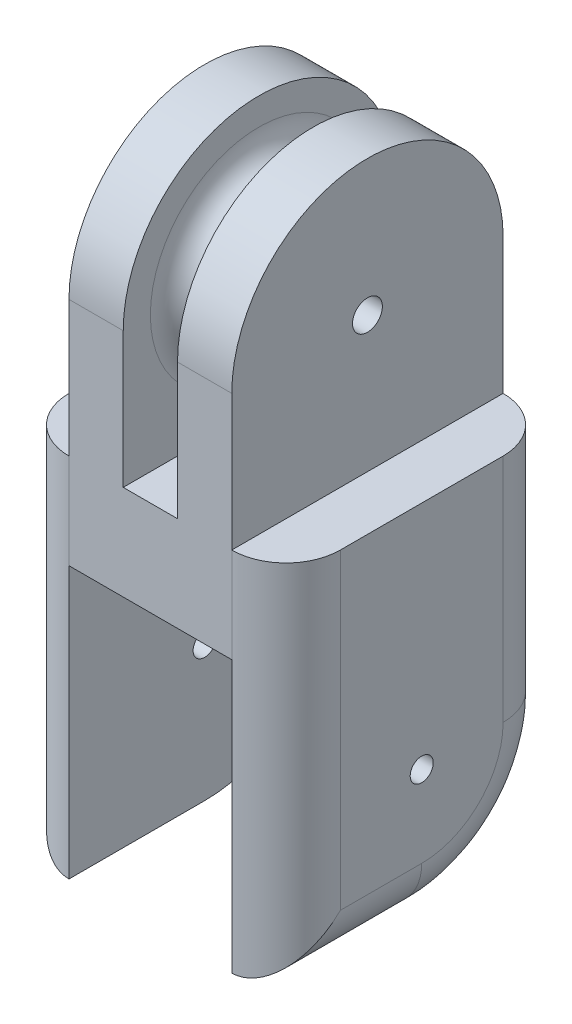
from build123d import *

# Parameters (mm, degrees)
SKETCH1_W           = 20
SKETCH1_H           = 20
BOSS_EXTRUDE1_DEPTH = 7
SKETCH4_W           = 4
SKETCH4_H           = 20
BOSS_EXTRUDE2_DEPTH = 10
BOSS_EXTRUDE3_DEPTH = 4
BOSS_EXTRUDE4_START = -4
BOSS_EXTRUDE4_DEPTH = 4
SKETCH7_R           = 0.85
CUT_EXTRUDE1_DEPTH  = 31
FILLET1_R           = 4
SKETCH8_W           = 4
SKETCH8_H           = 20
BOSS_EXTRUDE5_DEPTH = 10
SKETCH9_R           = 10
BOSS_EXTRUDE6_DEPTH = 4
BOSS_EXTRUDE7_START = -4
SKETCH10_R          = 10
BOSS_EXTRUDE7_DEPTH = 4
SKETCH12_R          = 1.1
CUT_EXTRUDE2_DEPTH  = 33.939338184
SKETCH13_R          = 6
BOSS_EXTRUDE8_DEPTH = 4
SKETCH14_R          = 1.1
CUT_EXTRUDE3_DEPTH  = 4
FILLET2_R           = 2
CUT_EXTRUDE4_REACH  = 32.48
SKETCH16_R          = 0.5


with BuildPart() as part:
    # Sketch1 → Boss-Extrude1 (new body)
    with BuildSketch(Plane(origin=(0, 0, 0), x_dir=(1, 0, 0), z_dir=(0, 1, 0))):
        Rectangle(SKETCH1_W, SKETCH1_H)
    extrude(amount=BOSS_EXTRUDE1_DEPTH)

    # Sketch4 → Boss-Extrude2 (add)
    with BuildSketch(Plane.XZ):
        with Locations((-8, 0)):
            Rectangle(SKETCH4_W, SKETCH4_H)
        with Locations((8, 0)):
            Rectangle(SKETCH4_W, SKETCH4_H)
    extrude(amount=BOSS_EXTRUDE2_DEPTH)

    # Sketch5 → Boss-Extrude3 (add)
    with BuildSketch(Plane.ZY.offset(10)):
        with BuildLine():
            Line((0, -20), (10, -20))
            Line((10, -20), (10, -10))
            ThreePointArc((10, -10), (-7.071067812, -2.928932188), (0, -20))
        make_face()
    extrude(amount=-BOSS_EXTRUDE3_DEPTH)

    # Sketch6 → Boss-Extrude4 (add)
    with BuildSketch(Plane(origin=(10, 0, 0), x_dir=(0, 0, -1), z_dir=(1, 0, 0)).offset(BOSS_EXTRUDE4_START)):
        with BuildLine():
            Line((0, -20), (-10, -20))
            Line((-10, -20), (-10, -10))
            ThreePointArc((-10, -10), (7.071067812, -2.928932188), (0, -20))
        make_face()
    extrude(amount=BOSS_EXTRUDE4_DEPTH)

    # Sketch7 → Cut-Extrude1 (cut, through all)
    with BuildSketch(Plane.ZY.offset(10)):
        with Locations((0, -10)):
            Circle(SKETCH7_R)
    extrude(amount=-CUT_EXTRUDE1_DEPTH, mode=Mode.SUBTRACT)

    # Fillet1
    fillet1_edges = [part.edges().sort_by_distance(p)[0] for p in [
        (-10, -6.5, 10),
        (-10, -17.071067812, -7.071067812),
        (10, -6.5, 10),
        (10, -17.071067812, -7.071067812),
        (-10, -1.5, -10),
        (10, -1.5, -10),
        (10, -20, 5),
        (-10, -20, 5),
    ]]
    fillet(fillet1_edges, radius=FILLET1_R - 0.0001)  # a hair under: the kernel refuses the full size

    # Sketch8 → Boss-Extrude5 (add)
    with BuildSketch(Plane(origin=(0, 7, 0), x_dir=(1, 0, 0), z_dir=(0, 1, 0))):
        with Locations((4, 0)):
            Rectangle(SKETCH8_W, SKETCH8_H)
        with Locations((-4, 0)):
            Rectangle(SKETCH8_W, SKETCH8_H)
    extrude(amount=BOSS_EXTRUDE5_DEPTH)

    # Sketch9 → Boss-Extrude6 (add)
    with BuildSketch(Plane(origin=(6, 0, 0), x_dir=(0, 0, -1), z_dir=(1, 0, 0))):
        with Locations((0, 17)):
            Circle(SKETCH9_R)
    extrude(amount=-BOSS_EXTRUDE6_DEPTH)

    # Sketch10 → Boss-Extrude7 (add)
    with BuildSketch(Plane.ZY.offset(6).offset(BOSS_EXTRUDE7_START)):
        with Locations((0, 17)):
            Circle(SKETCH10_R)
    extrude(amount=BOSS_EXTRUDE7_DEPTH)

    # Sketch12 → Cut-Extrude2 (cut, through all)
    with BuildSketch(Plane.ZY.offset(6)):
        with Locations((0, 17)):
            Circle(SKETCH12_R)
    extrude(amount=-CUT_EXTRUDE2_DEPTH, mode=Mode.SUBTRACT)

    # Sketch13 → Boss-Extrude8 (add)
    with BuildSketch(Plane(origin=(-2, 0, 0), x_dir=(0, 0, -1), z_dir=(1, 0, 0))):
        with Locations(Location((0, 17, 0), (0, 0, 180))):
            Circle(SKETCH13_R)
    extrude(amount=BOSS_EXTRUDE8_DEPTH)

    # Sketch14 → Cut-Extrude3 (cut)
    with BuildSketch(Plane(origin=(-2, 0, 0), x_dir=(0, 0, -1), z_dir=(1, 0, 0))):
        with Locations(Location((0, 17, 0), (0, 0, 180))):
            Circle(SKETCH14_R)
    extrude(amount=CUT_EXTRUDE3_DEPTH, mode=Mode.SUBTRACT)

    # Fillet2
    fillet2_edges = [part.edges().sort_by_distance(p)[0] for p in [
        (-2, 17, -6),
        (2, 17, -6),
    ]]
    fillet(fillet2_edges, radius=FILLET2_R - 0.0001)  # a hair under: the kernel refuses the full size

    # Sketch16 → Cut-Extrude4 (cut, up to next)
    with BuildSketch(Plane.XZ, mode=Mode.PRIVATE) as cut_extrude4_sk1:
        with Locations(Location((0, -6, 0), (0, 0, 270))):
            Circle(SKETCH16_R)
    cut_extrude4_tool1 = extrude(cut_extrude4_sk1.sketch, amount=-CUT_EXTRUDE4_REACH, mode=Mode.PRIVATE) & part.part
    # Sketch16 → Cut-Extrude4 (cut, up to next)
    with BuildSketch(Plane.XZ, mode=Mode.PRIVATE) as cut_extrude4_sk2:
        with Locations(Location((0, 6, 0), (0, 0, 90))):
            Circle(SKETCH16_R)
    cut_extrude4_tool2 = extrude(cut_extrude4_sk2.sketch, amount=-CUT_EXTRUDE4_REACH, mode=Mode.PRIVATE) & part.part
    add(cut_extrude4_tool1.solids().sort_by_distance((0, 0, -6))[0], mode=Mode.SUBTRACT)
    add(cut_extrude4_tool2.solids().sort_by_distance((0, 0, 6))[0], mode=Mode.SUBTRACT)


solid = part.part
